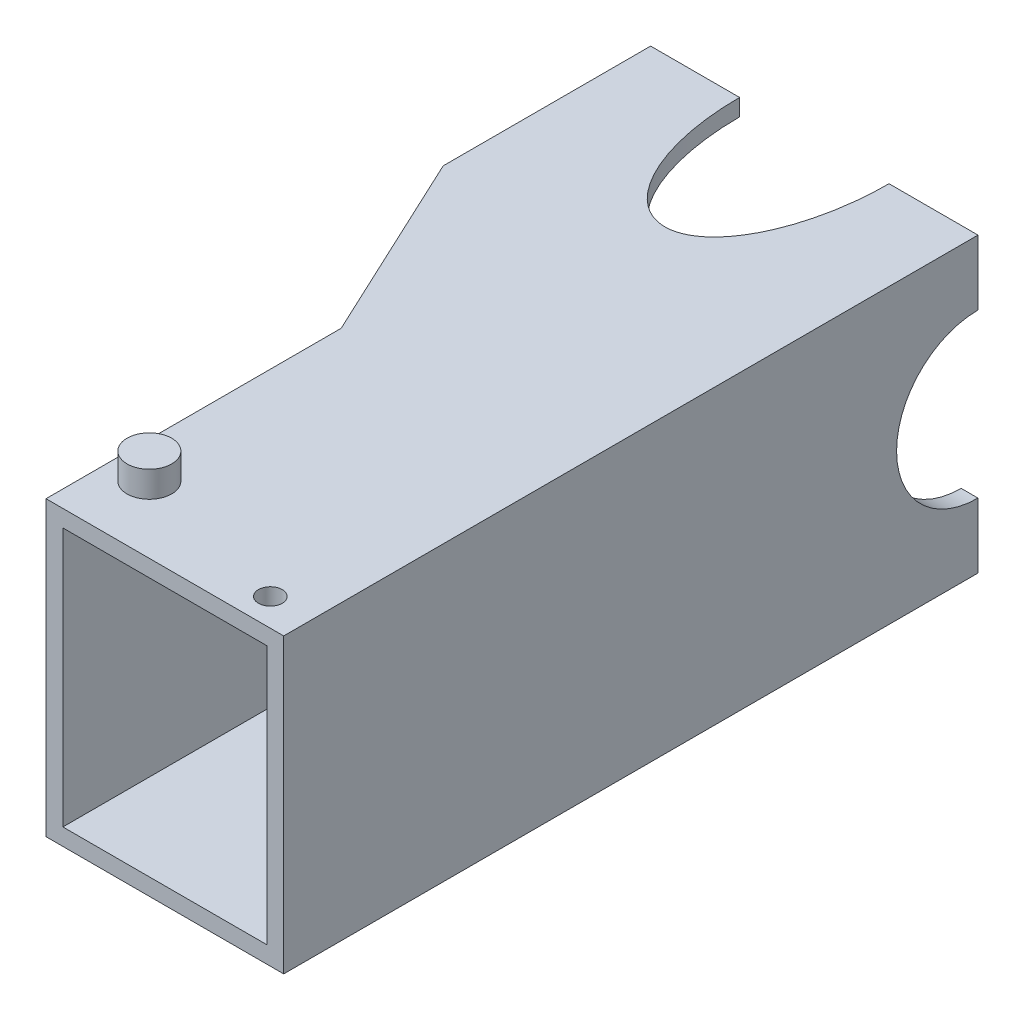
from build123d import *

# Parameters (mm, degrees)
ESQUISSE1_W                 = 44.03
ESQUISSE1_H                 = 39.37
BOSS_EXTRU_1_DEPTH          = 93.38
ESQUISSE2_W                 = 12.06
ESQUISSE2_H                 = 39.7
ENL_V_MAT_EXTRU_1_DEPTH     = 93.38
ENL_V_START                 = -68.526093067
ENL_V_MAT_EXTRU_2_OUTLINE_W = 39.37
ENL_V_MAT_EXTRU_2_OUTLINE_H = 28.461412473
ENL_V_MAT_EXTRU_2_DEPTH     = 16.822144735
ESQUISSE4_W                 = 39.49
ESQUISSE4_H                 = 34.83
ENL_V_MAT_EXTRU_3_DEPTH     = 27.4
ESQUISSE5_W                 = 27.43
ESQUISSE5_H                 = 34.83
ENL_V_MAT_EXTRU_4_DEPTH     = 100
ENL_V_START_2               = -2.27
ESQUISSE6_W                 = 28.461412473
ESQUISSE6_H                 = 34.83
ENL_V_MAT_EXTRU_7_DEPTH     = 20
CONG_2_R                    = 10
ESQUISSE7_R                 = 3
BOSS_EXTRU_2_DEPTH          = 3.5
BOSS_EXTRU_3_START          = 3.5
ESQUISSE8_R                 = 3
BOSS_EXTRU_3_DEPTH          = 3.5
ESQUISSE9_R                 = 1.6
ENL_V_MAT_EXTRU_8_DEPTH     = 3.5
ESQUISSE10_RX               = 20.1
ESQUISSE10_RY               = 10.05
ENL_V_MAT_EXTRU_9_DEPTH     = 100
ESQUISSE12_R                = 10.95
ENL_V_MAT_EXTRU_10_DEPTH    = 100


with BuildPart() as part:
    # Esquisse1 → Boss.-Extru.1 (new body)
    with BuildSketch(Plane.XY):
        with Locations((-22.015, -19.685)):
            Rectangle(ESQUISSE1_W, ESQUISSE1_H)
    extrude(amount=BOSS_EXTRU_1_DEPTH)

    # Esquisse2 → Enlèv. mat.-Extru.1 (cut)
    with BuildSketch(Plane(origin=(0, 0, 0), x_dir=(1, 0, 0), z_dir=(0, 1, 0))):
        with Locations((-38, -73.53)):
            Rectangle(ESQUISSE2_W, ESQUISSE2_H)
    extrude(amount=-ENL_V_MAT_EXTRU_1_DEPTH, mode=Mode.SUBTRACT)

    # Enlèv. mat.-Extru.2: read off the stored shape, not the designer's step
    # Enlèv. mat.-Extru.2 outline → Enlèv. mat.-Extru.2 (cut)
    with BuildSketch(Plane(origin=(0, 0, 0), x_dir=(0, 1, 0), z_dir=(0.905787793342715, 0, -0.423731605419439)).offset(ENL_V_START)):
        with Locations((-19.685, 20.845283085)):
            Rectangle(ENL_V_MAT_EXTRU_2_OUTLINE_W, ENL_V_MAT_EXTRU_2_OUTLINE_H)
    extrude(amount=ENL_V_MAT_EXTRU_2_DEPTH, mode=Mode.SUBTRACT)

    # Esquisse4 → Enlèv. mat.-Extru.3 (cut)
    with BuildSketch(Plane(origin=(0, 0, 0), x_dir=(-1, 0, 0), z_dir=(0, 0, -1))):
        with Locations((22.015, -19.685)):
            Rectangle(ESQUISSE4_W, ESQUISSE4_H)
    extrude(amount=-ENL_V_MAT_EXTRU_3_DEPTH, mode=Mode.SUBTRACT)

    # Esquisse5 → Enlèv. mat.-Extru.4 (cut)
    with BuildSketch(Plane.XY.offset(93.38)):
        with Locations((-15.985, -19.685)):
            Rectangle(ESQUISSE5_W, ESQUISSE5_H)
    extrude(amount=-ENL_V_MAT_EXTRU_4_DEPTH, mode=Mode.SUBTRACT)

    # Esquisse6 → Enlèv. mat.-Extru.7 (cut)
    with BuildSketch(Plane(origin=(-46.832805267, 0, 21.908597033), x_dir=(0.42373160541943916, 0, 0.9057877933427149), z_dir=(-0.9057877933427149, 0, 0.42373160541943916)).offset(ENL_V_START_2)):
        with Locations((20.845283085, -19.685)):
            Rectangle(ESQUISSE6_W, ESQUISSE6_H)
    extrude(amount=-ENL_V_MAT_EXTRU_7_DEPTH, mode=Mode.SUBTRACT)

    # Congé2
    # the kernel refuses this fillet: 10 mm, written as the material it takes off along each edge
    with BuildSketch(Plane(origin=(-29.7, -37.1, 52.618083786), x_dir=(0, 0, 1), z_dir=(0, 1, 0))) as cong_2_piece_1:
        with BuildLine():
            CenterArc((2.157105836, -10), CONG_2_R, 90, 11.870832878)
            Line((0.10004547, -0.213861709), (0, 0))
            Line((0, 0), (2.157105836, 0))
        make_face()
    extrude(amount=34.83, mode=Mode.SUBTRACT)

    # Esquisse7 → Boss.-Extru.2 (add)
    with BuildSketch(Plane(origin=(0, -39.37, 0), x_dir=(-1, 0, 0), z_dir=(0, -1, 0))):
        with Locations((27.07, -84.38)):
            Circle(ESQUISSE7_R)
    extrude(amount=BOSS_EXTRU_2_DEPTH)

    # Esquisse8 → Boss.-Extru.3 (add)
    with BuildSketch(Plane(origin=(0, 0, 0), x_dir=(1, 0, 0), z_dir=(0, 1, 0)).offset(BOSS_EXTRU_3_START)):
        with Locations(Location((-27.07, -84.38, 0), (0, 0, 180))):
            Circle(ESQUISSE8_R)
    extrude(amount=-BOSS_EXTRU_3_DEPTH)

    # Esquisse9 → Enlèv. mat.-Extru.8 (cut)
    with BuildSketch(Plane(origin=(0, 0, 0), x_dir=(1, 0, 0), z_dir=(0, 1, 0))):
        with Locations(Location((-5.5, -89.68, 0), (0, 0, 180))):
            Circle(ESQUISSE9_R)
    extrude(amount=-ENL_V_MAT_EXTRU_8_DEPTH, mode=Mode.SUBTRACT)

    # Esquisse10 → Enlèv. mat.-Extru.9 (cut)
    with BuildSketch(Plane(origin=(0, 0, 0), x_dir=(1, 0, 0), z_dir=(0, 1, 0))):
        with Locations(Location((-22.015, 0), (0, 0, -90))):
            Ellipse(ESQUISSE10_RX, ESQUISSE10_RY)
    extrude(amount=-ENL_V_MAT_EXTRU_9_DEPTH, mode=Mode.SUBTRACT)

    # Esquisse12 → Enlèv. mat.-Extru.10 (cut)
    with BuildSketch(Plane(origin=(0, 0, 0), x_dir=(0, 0, -1), z_dir=(1, 0, 0))):
        with Locations((0, -19.685)):
            Circle(ESQUISSE12_R)
    extrude(amount=-ENL_V_MAT_EXTRU_10_DEPTH, mode=Mode.SUBTRACT)


solid = part.part
